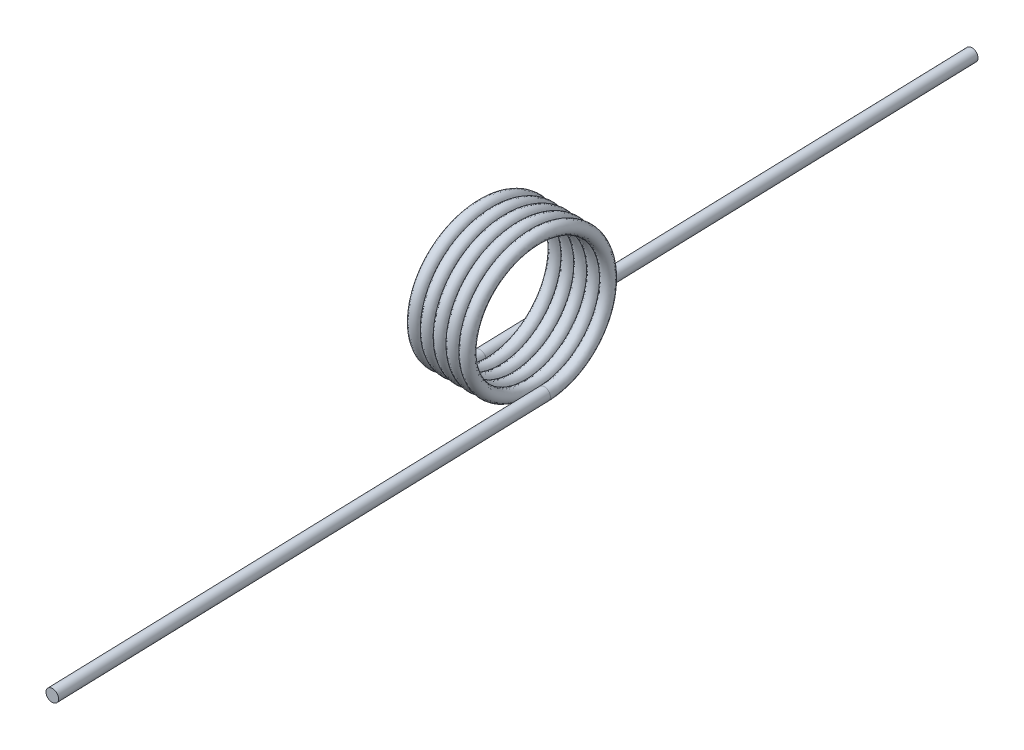
from build123d import *

# Parameters (mm, degrees)
SWEEP1_PITCH       = 0.4826
SWEEP1_HEIGHT      = 2.413
SWEEP1_RADIUS      = 2.5146
SWEEP1_START_ANGLE = 90
SKETCH2_R          = 0.2286
SKETCH3_R          = 0.2286
EXTRUDE1_DEPTH     = 19.05
SKETCH4_R          = 0.2286
EXTRUDE2_DEPTH     = 19.05


with BuildPart() as part:
    # Sweep1: sweep along a helix
    with BuildLine() as sweep1_path:
        add(Helix(SWEEP1_PITCH, SWEEP1_HEIGHT, SWEEP1_RADIUS, center=(0, 0, 0), direction=(1, 0, 0), lefthand=True, mode=Mode.PRIVATE).rotate(Axis((0, 0, 0), (1, 0, 0)), SWEEP1_START_ANGLE))
    # Sketch2 → Sweep1 (sweep)
    with BuildSketch(Plane(origin=(0, -2.5146, 0), x_dir=(0.9995338310793739, 2.667680615204326e-14, -0.03053064899064011), z_dir=(0.03053064899064011, -9.277902487075232e-15, 0.9995338310793739))):
        Circle(SKETCH2_R)
    sweep(path=sweep1_path.line, is_frenet=True)

    # Sketch3 → Extrude1 (add)
    with BuildSketch(Plane(origin=(0, 0, 0), x_dir=(-0.9995338310793739, -2.6649053239501496e-14, 0.03053064899064011), z_dir=(-0.03053064899064011, 9.277902487075232e-15, -0.9995338310793739))):
        with Locations(Location((0, -2.5146, 0), (0, 0, 180))):
            Circle(SKETCH3_R)
    extrude(amount=EXTRUDE1_DEPTH)

    # Sketch4 → Extrude2 (add)
    with BuildSketch(Plane(origin=(0.002249207, 0, 0.073636113), x_dir=(0.9958648501302635, -0.08560321397472048, -0.030418580378220504), z_dir=(0.0305306489906401, 5.696875263194733e-14, 0.9995338310793739))):
        with Locations(Location((2.618279725, -2.298905414, 0), (0, 0, 4.910712917))):
            Circle(SKETCH4_R)
    extrude(amount=EXTRUDE2_DEPTH)


solid = part.part
